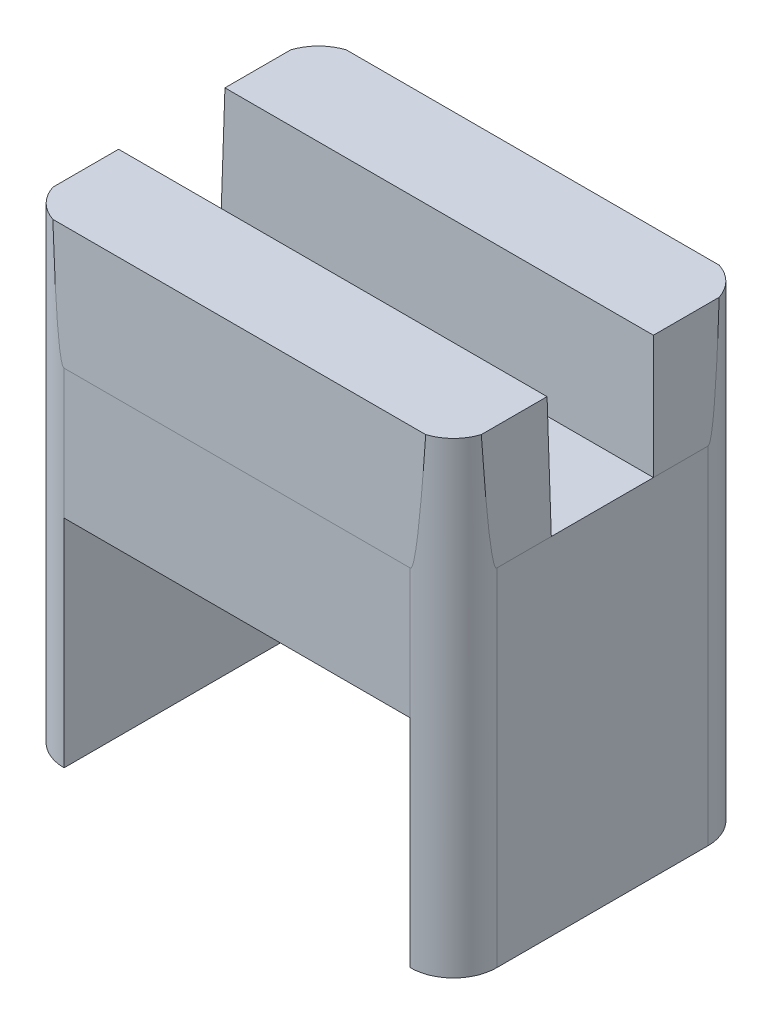
from build123d import *

# Parameters (mm, degrees)
BOSS_EXTRUDE1_DEPTH           = 34.4
SKETCH2_W                     = 50
SKETCH2_H                     = 11.3
BOSS_EXTRUDE2_DEPTH           = 14
BOSS_EXTRUDE2_DRAFT           = 1
BOSS_EXTRUDE2_PROFILE_2_DEPTH = 14
BOSS_EXTRUDE2_PROFILE_2_DRAFT = 1
FILLET1_R                     = 5


with BuildPart() as part:
    # Sketch1 → Boss-Extrude1 (new body)
    with BuildSketch(Plane.XY):
        Polygon((45, 0), (50, 0), (50, 40), (0, 40), (0, 0), (5, 0), (5, 25), (45, 25), align=None)
    extrude(amount=BOSS_EXTRUDE1_DEPTH)


with BuildPart() as boss_extrude2_tool:
    # Sketch2 → Boss-Extrude2 (with draft: the straight prism first)
    with BuildSketch(Plane(origin=(0, 40, 0), x_dir=(1, 0, 0), z_dir=(0, 1, 0))):
        with Locations((25, -5.65)):
            Rectangle(SKETCH2_W, SKETCH2_H)
    extrude(amount=BOSS_EXTRUDE2_DEPTH)
    # Boss-Extrude2: the draft: its side faces are tilted about the plane it starts from
    boss_extrude2_sides = [boss_extrude2_tool.faces().sort_by_distance(p)[0] for p in [
        (0, 47, 5.65),
        (25, 47, 11.3),
        (50, 47, 5.65),
        (25, 47, 0),
    ]]
    draft(boss_extrude2_sides, Plane(origin=(0, 40, 0), x_dir=(1, 0, 0), z_dir=(0, 1, 0)), BOSS_EXTRUDE2_DRAFT)


with BuildPart() as part_1:
    add(part.part)

    # Boss-Extrude2: add boss_extrude2_tool
    add(boss_extrude2_tool.part)


with BuildPart() as boss_extrude2_profile_2_tool:
    # Sketch2 → Boss-Extrude2 profile 2 (with draft: the straight prism first)
    with BuildSketch(Plane(origin=(0, 40, 0), x_dir=(1, 0, 0), z_dir=(0, 1, 0))):
        with Locations((25, -28.75)):
            Rectangle(SKETCH2_W, SKETCH2_H)
    extrude(amount=BOSS_EXTRUDE2_PROFILE_2_DEPTH)
    # Boss-Extrude2 profile 2: the draft: its side faces are tilted about the plane it starts from
    boss_extrude2_profile_2_sides = [boss_extrude2_profile_2_tool.faces().sort_by_distance(p)[0] for p in [
        (25, 47, 34.4),
        (50, 47, 28.75),
        (25, 47, 23.1),
        (0, 47, 28.75),
    ]]
    draft(boss_extrude2_profile_2_sides, Plane(origin=(0, 40, 0), x_dir=(1, 0, 0), z_dir=(0, 1, 0)), BOSS_EXTRUDE2_PROFILE_2_DRAFT)


with BuildPart() as part_2:
    add(part_1.part)

    # Boss-Extrude2 profile 2: add boss_extrude2_profile_2_tool
    add(boss_extrude2_profile_2_tool.part)

    # Fillet1
    # the kernel refuses this fillet: 5 mm, written as the material it takes off along each edge
    with BuildSketch(Plane(origin=(50, -30, 34.4), x_dir=(-1, 0, 0), z_dir=(0, 1, 0)), Plane(origin=(0, 70, 0), x_dir=(0, 0, 1), z_dir=(0, -1, 0))) as fillet1_piece_1:
        with BuildLine():
            CenterArc((FILLET1_R, -FILLET1_R), FILLET1_R, 90, 90)
            Line((0, -FILLET1_R), (-FILLET1_R * 0.02, -FILLET1_R))
            Line((-FILLET1_R * 0.02, -FILLET1_R), (-FILLET1_R * 0.02, FILLET1_R * 0.02))
            Line((-FILLET1_R * 0.02, FILLET1_R * 0.02), (FILLET1_R, FILLET1_R * 0.02))
            Line((FILLET1_R, FILLET1_R * 0.02), (FILLET1_R, 0))
        make_face()
    extrude(amount=100, mode=Mode.SUBTRACT)
    with BuildSketch(Plane(origin=(50, -30, 0), x_dir=(-1, 0, 0), z_dir=(0, 1, 0)), Plane(origin=(0, 70, 34.4), x_dir=(0, 0, -1), z_dir=(0, -1, 0))) as fillet1_piece_2:
        with BuildLine():
            CenterArc((FILLET1_R, FILLET1_R), FILLET1_R, 180, 90)
            Line((0, FILLET1_R), (-FILLET1_R * 0.02, FILLET1_R))
            Line((-FILLET1_R * 0.02, FILLET1_R), (-FILLET1_R * 0.02, -FILLET1_R * 0.02))
            Line((-FILLET1_R * 0.02, -FILLET1_R * 0.02), (FILLET1_R, -FILLET1_R * 0.02))
            Line((FILLET1_R, -FILLET1_R * 0.02), (FILLET1_R, 0))
        make_face()
    extrude(amount=100, mode=Mode.SUBTRACT)


solid = part_2.part
